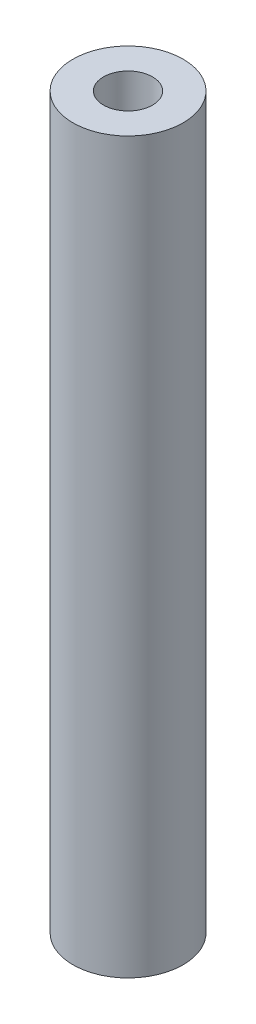
from build123d import *

# Parameters (mm, degrees)
SKETCH1_R           = 2.7
SKETCH1_R_2         = 1.2
BOSS_EXTRUDE1_DEPTH = 35.7


with BuildPart() as part:
    # Sketch1 → Boss-Extrude1 (new body)
    with BuildSketch(Plane(origin=(0, 0, 0), x_dir=(1, 0, 0), z_dir=(0, 1, 0))):
        Circle(SKETCH1_R)
        Circle(SKETCH1_R_2, mode=Mode.SUBTRACT)
    extrude(amount=BOSS_EXTRUDE1_DEPTH)


solid = part.part
